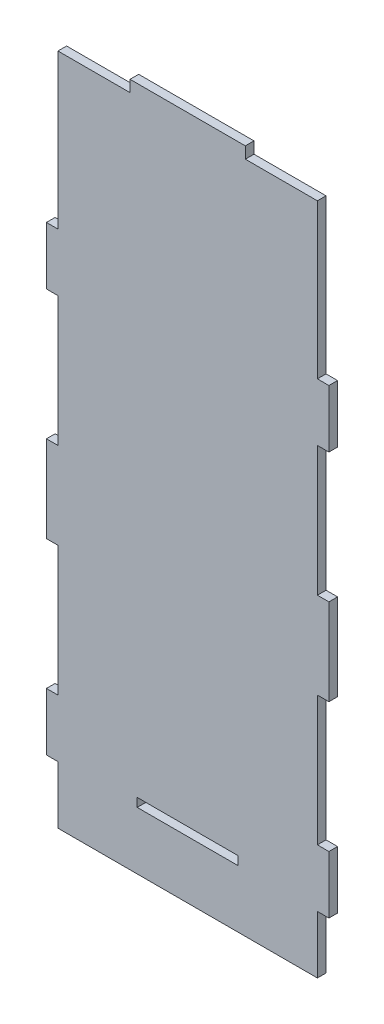
from build123d import *

# Parameters (mm, degrees)
SKETCH1_W           = 90
SKETCH1_H           = 200
BOSS_EXTRUDE1_DEPTH = 3
SKETCH3_W           = 3
SKETCH3_H           = 20
SKETCH3_H_2         = 30
BOSS_EXTRUDE2_DEPTH = 3
SKETCH2_W           = 23
SKETCH2_H           = 20
SKETCH2_R           = 2.5
SKETCH2_H_2         = 30
BOSS_EXTRUDE3_DEPTH = 3
BOSS_EXTRUDE4_DEPTH = 3
SKETCH6_W           = 19
SKETCH6_H           = 160
CUT_EXTRUDE2_DEPTH  = 10
SKETCH7_W           = 35
SKETCH7_H           = 3
CUT_EXTRUDE3_DEPTH  = 4


with BuildPart() as part:
    # Sketch1 → Boss-Extrude1 (new body)
    with BuildSketch(Plane.XY):
        with Locations((45, 100)):
            Rectangle(SKETCH1_W, SKETCH1_H)
    extrude(amount=BOSS_EXTRUDE1_DEPTH)

    # Sketch3 → Boss-Extrude2 (add)
    with BuildSketch(Plane.XY.offset(3)):
        with Locations((-1.5, 170)):
            Rectangle(SKETCH3_W, SKETCH3_H)
        with Locations((91.5, 170)):
            Rectangle(SKETCH3_W, SKETCH3_H)
        with Locations((91.5, 100)):
            Rectangle(SKETCH3_W, SKETCH3_H_2)
        with Locations((-1.5, 100)):
            Rectangle(SKETCH3_W, SKETCH3_H_2)
        with Locations((-1.5, 30)):
            Rectangle(SKETCH3_W, SKETCH3_H)
        with Locations((91.5, 30)):
            Rectangle(SKETCH3_W, SKETCH3_H)
    extrude(amount=-BOSS_EXTRUDE2_DEPTH)

    # Sketch2 → Boss-Extrude3 (add)
    # profile 1 of 6: a face of its own
    with BuildSketch(Plane.XY.offset(3)):
        with Locations((-11.5, 170)):
            Rectangle(SKETCH2_W, SKETCH2_H)
        with Locations((-11.5, 170)):
            Circle(SKETCH2_R, mode=Mode.SUBTRACT)
    # profile 2 of 6: a face of its own
    with BuildSketch(Plane.XY.offset(3)):
        with Locations((-11.5, 30)):
            Rectangle(SKETCH2_W, SKETCH2_H)
        with Locations((-11.5, 30)):
            Circle(SKETCH2_R, mode=Mode.SUBTRACT)
    # profile 3 of 6: a face of its own
    with BuildSketch(Plane.XY.offset(3)):
        with Locations((-11.5, 100)):
            Rectangle(SKETCH2_W, SKETCH2_H_2)
        with Locations((-11.5, 100)):
            Circle(SKETCH2_R, mode=Mode.SUBTRACT)
    # profile 4 of 6: a face of its own
    with BuildSketch(Plane.XY.offset(3)):
        with Locations((101.5, 30)):
            Rectangle(SKETCH2_W, SKETCH2_H)
        with Locations((101.5, 30)):
            Circle(SKETCH2_R, mode=Mode.SUBTRACT)
    # profile 5 of 6: a face of its own
    with BuildSketch(Plane.XY.offset(3)):
        with Locations((101.5, 100)):
            Rectangle(SKETCH2_W, SKETCH2_H_2)
        with Locations((101.5, 100)):
            Circle(SKETCH2_R, mode=Mode.SUBTRACT)
    # profile 6 of 6: a face of its own
    with BuildSketch(Plane.XY.offset(3)):
        with Locations((101.5, 170)):
            Rectangle(SKETCH2_W, SKETCH2_H)
        with Locations((101.5, 170)):
            Circle(SKETCH2_R, mode=Mode.SUBTRACT)
    extrude(amount=-BOSS_EXTRUDE3_DEPTH)

    # Sketch4 → Boss-Extrude4 (add)
    with BuildSketch(Plane.XY.offset(3)):
        Polygon((0, 233.5), (0, 200), (90, 200), (90, 233.5), (65, 233.5), (65, 237.5), (25, 237.5), (25, 233.5), align=None)
    extrude(amount=-BOSS_EXTRUDE4_DEPTH)

    # Sketch6 → Cut-Extrude2 (cut)
    with BuildSketch(Plane(origin=(0, 0, 0), x_dir=(-1, 0, 0), z_dir=(0, 0, -1))):
        with Locations((-103.5, 100)):
            Rectangle(SKETCH6_W, SKETCH6_H)
        with Locations((13.5, 100)):
            Rectangle(SKETCH6_W, SKETCH6_H)
    extrude(amount=-CUT_EXTRUDE2_DEPTH, mode=Mode.SUBTRACT)

    # Sketch7 → Cut-Extrude3 (cut)
    with BuildSketch(Plane(origin=(0, 0, 0), x_dir=(-1, 0, 0), z_dir=(0, 0, -1))):
        with Locations((-45, 21.5)):
            Rectangle(SKETCH7_W, SKETCH7_H)
    extrude(amount=-CUT_EXTRUDE3_DEPTH, mode=Mode.SUBTRACT)


solid = part.part
